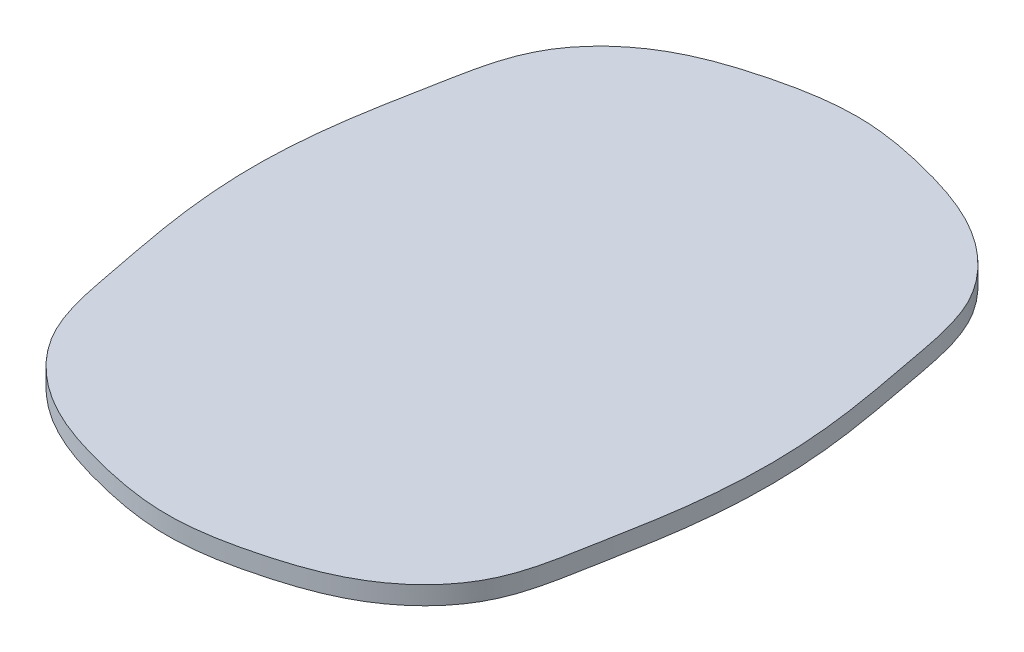
from build123d import *

# Parameters (mm, degrees)
MAINBODY_DEPTH = 10


with BuildPart() as part:
    # Sketch2 → MainBody (new body)
    with BuildSketch(Plane(origin=(0, 0, 0), x_dir=(1, 0, 0), z_dir=(0, 1, 0))):
        with BuildLine():
            add(Edge.make_bspline(
                [(0, 188.5), (14.94116244, 188.499999362), (44.823534991, 182.843890655), (87.705883872, 168.159119184), (121.85292952, 134.636400469), (129.882398047, 89.134539095), (138.608263985, 45.336705786), (142.139244966, 0.346290505), (138.827522783, -44.660795494), (130.315166428, -88.500625879), (122.507502134, -134.041070887), (88.524202095, -167.729773964), (45.713914165, -182.623316394), (0.93222672, -191.325782611), (-43.931996273, -183.06012727), (-86.885817137, -168.584458337), (-121.194224208, -135.228584973), (-129.451171122, -89.76614416), (-138.41378838, -45.7899286), (-142.245159249, -0.346548541), (-138.635257826, 45.114960515), (-129.887022133, 89.13432461), (-121.851690074, 134.63645792), (-87.706217569, 168.159103863), (-44.823439649, 182.843894485), (-14.94116244, 188.500000638), (0, 188.5)],
                knots=[0, 0, 0, 0, 0.041635792, 0.083271583, 0.124907375, 0.166543166, 0.208178958, 0.249682989, 0.29118702, 0.332822812, 0.374458603, 0.416094395, 0.457730186, 0.499365978, 0.541001769, 0.582637561, 0.624273352, 0.665909144, 0.707544935, 0.749682989, 0.791821042, 0.833456834, 0.875092625, 0.916728417, 0.958364208, 1, 1, 1, 1], degree=3))
        make_face()
    extrude(amount=MAINBODY_DEPTH)


solid = part.part
